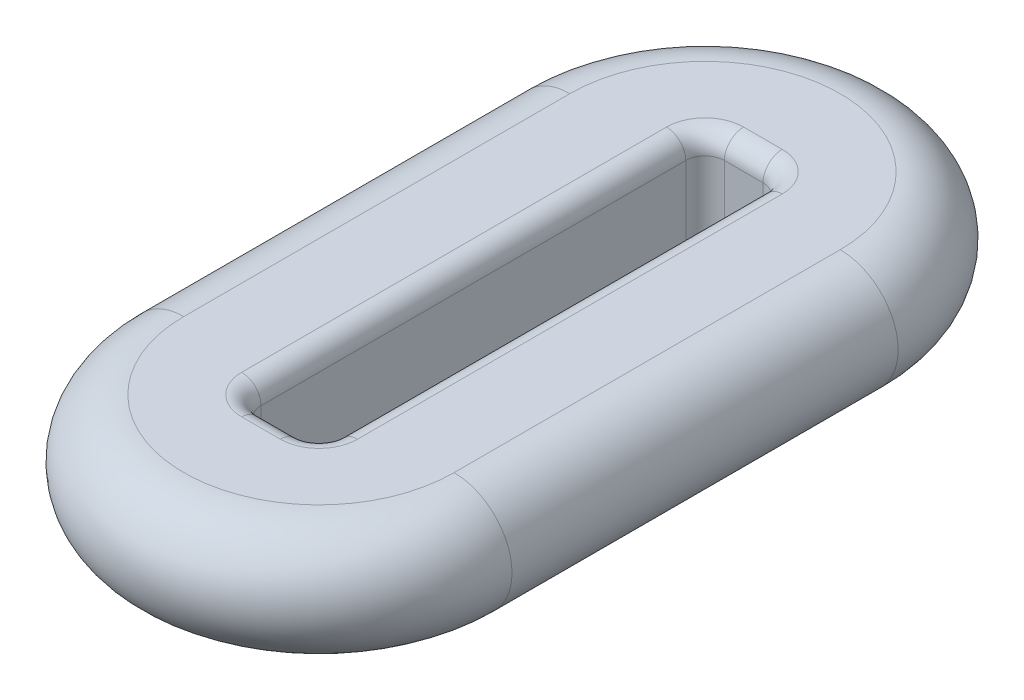
from build123d import *

# Parameters (mm, degrees)
SKETCH1_W      = 10
SKETCH1_H      = 20
SKETCH1_W_2    = 2
SKETCH1_H_2    = 12
EXTRUDE1_DEPTH = 1.5
FILLET1_RADIUS = 5
FILLET1_LENGTH = 3
FILLET5_RADIUS = 5
FILLET5_LENGTH = 3
FILLET3_R      = 0.5
FILLET4_R      = 0.5
FILLET6_R      = 1.5


with BuildPart() as part:
    # Sketch1 → Extrude1 (new, symmetric)
    with BuildSketch(Plane(origin=(0, 0, 0), x_dir=(1, 0, 0), z_dir=(0, 1, 0))):
        Rectangle(SKETCH1_W, SKETCH1_H)
        Rectangle(SKETCH1_W_2, SKETCH1_H_2, mode=Mode.SUBTRACT)
    extrude(amount=EXTRUDE1_DEPTH, both=True)

    # Fillet1: full round fillet: the end face becomes a half cylinder, R = half its width
    fillet1_face = Plane((0, 0, 10), x_dir=(0, 1, 0), z_dir=(0, 0, 1))  # on the end face: x along it, z out of the body
    fillet1_slab = fillet1_face.offset(-FILLET1_RADIUS / 2) * Box(FILLET1_LENGTH, 2 * FILLET1_RADIUS, FILLET1_RADIUS, mode=Mode.PRIVATE)  # the body's end, R deep
    fillet1_round = Plane((0, 0, 5), x_dir=(0, 0, 1), z_dir=(0, 1, 0)) * Cylinder(FILLET1_RADIUS, FILLET1_LENGTH, mode=Mode.PRIVATE)  # its axis R under the face
    add(fillet1_slab - fillet1_round, mode=Mode.SUBTRACT)

    # Fillet5: full round fillet: the end face becomes a half cylinder, R = half its width
    fillet5_face = Plane((0, 0, -10), x_dir=(0, 1, 0), z_dir=(0, 0, -1))  # on the end face: x along it, z out of the body
    fillet5_slab = fillet5_face.offset(-FILLET5_RADIUS / 2) * Box(FILLET5_LENGTH, 2 * FILLET5_RADIUS, FILLET5_RADIUS, mode=Mode.PRIVATE)  # the body's end, R deep
    fillet5_round = Plane((0, 0, -5), x_dir=(0, 0, -1), z_dir=(0, 1, 0)) * Cylinder(FILLET5_RADIUS, FILLET5_LENGTH, mode=Mode.PRIVATE)  # its axis R under the face
    add(fillet5_slab - fillet5_round, mode=Mode.SUBTRACT)

    # Fillet3
    fillet3_edges = [part.edges().sort_by_distance(p)[0] for p in [
        (-1, 0, -6),
        (-1, 0, 6),
        (1, 0, 6),
        (1, 0, -6),
    ]]
    fillet(fillet3_edges, radius=FILLET3_R)

    # Fillet4
    fillet4_edges = [part.edges().sort_by_distance(p)[0] for p in [
        (1, -1.5, 0),
        (1, 1.5, 0),
        (0, -1.5, -6),
        (0, 1.5, -6),
        (-1, -1.5, 0),
        (-1, 1.5, 0),
        (0, -1.5, 6),
        (0, 1.5, 6),
        (0.853553391, -1.5, -5.853553391),
        (0.853553391, 1.5, -5.853553391),
        (-0.853553391, -1.5, -5.853553391),
        (-0.853553391, 1.5, -5.853553391),
        (0.853553391, -1.5, 5.853553391),
        (0.853553391, 1.5, 5.853553391),
        (-0.853553391, -1.5, 5.853553391),
        (-0.853553391, 1.5, 5.853553391),
    ]]
    fillet(fillet4_edges, radius=FILLET4_R)

    # Fillet6
    fillet6_edges = [part.edges().sort_by_distance(p)[0] for p in [
        (5, -1.5, 0),
        (5, 1.5, 0),
        (0, 1.5, 10),
        (-5, -1.5, 0),
        (-5, 1.5, 0),
        (0, -1.5, -10),
    ]]
    fillet(fillet6_edges, radius=FILLET6_R - 0.0001)  # a hair under: the kernel refuses the full size


solid = part.part
